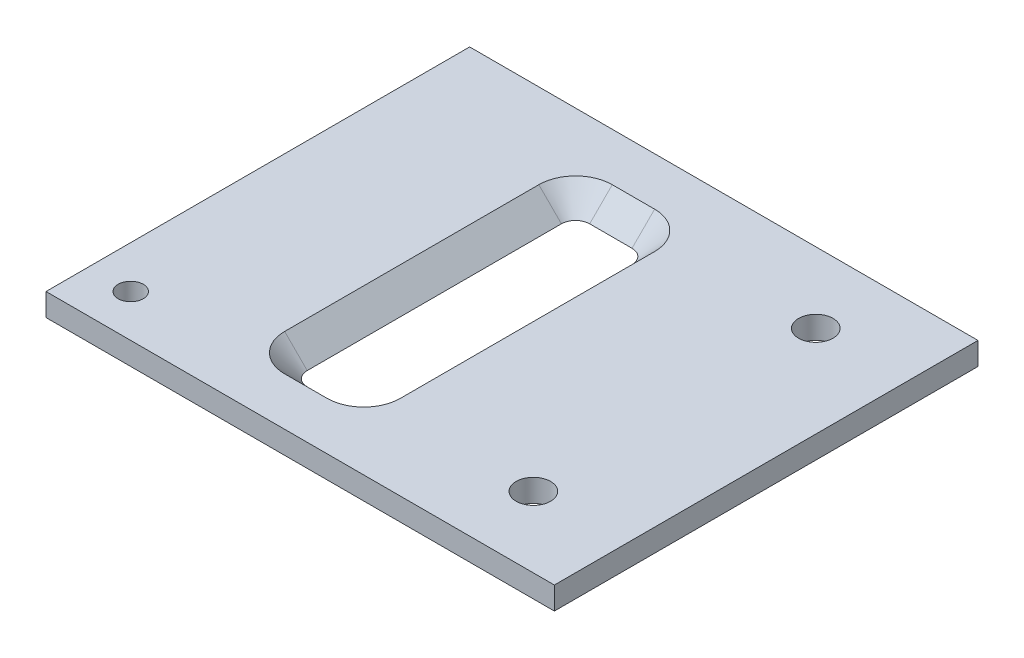
from build123d import *

# Parameters (mm, degrees)
SKETCH2_W             = 36
SKETCH2_H             = 30
BOSS_EXTRUDE1_DEPTH   = 1.6002
CUT_EXTRUDE4_DEPTH    = 26.856539599
CUT_EXTRUDE4_TAPER    = -45
F_2_CLEARANCE_HOLE1_D = 2.4384
F_0_CLEARANCE_HOLE1_D = 1.778


with BuildPart() as part:
    # Sketch2 → Boss-Extrude1 (new body)
    with BuildSketch(Plane(origin=(0, 0, 0), x_dir=(1, 0, 0), z_dir=(0, 1, 0))):
        with Locations((3, 0)):
            Rectangle(SKETCH2_W, SKETCH2_H)
    extrude(amount=BOSS_EXTRUDE1_DEPTH)

    # Sketch4 → Cut-Extrude4 (cut, through all)
    with BuildSketch(Plane(origin=(0, 0, 0), x_dir=(1, 0, 0), z_dir=(0, 1, 0))):
        with BuildLine():
            ThreePointArc((1.5, -10), (2.207106781, -9.707106781), (2.5, -9))
            Line((2.5, -9), (2.5, 9))
            ThreePointArc((2.5, 9), (2.207106781, 9.707106781), (1.5, 10))
            Line((1.5, 10), (-1.5, 10))
            ThreePointArc((-1.5, 10), (-2.207106781, 9.707106781), (-2.5, 9))
            Line((-2.5, 9), (-2.5, -9))
            ThreePointArc((-2.5, -9), (-2.207106781, -9.707106781), (-1.5, -10))
            Line((-1.5, -10), (1.5, -10))
        make_face()
    extrude(amount=CUT_EXTRUDE4_DEPTH, taper=CUT_EXTRUDE4_TAPER, mode=Mode.SUBTRACT)

    # #2 Clearance Hole1 (through all)
    with Locations(Plane(origin=(0, 0, 0), x_dir=(-1, 0, 0), z_dir=(0, -1, 0))):
        with Locations((-14.513821803, -10), (-14.513821803, 10)):
            Hole(F_2_CLEARANCE_HOLE1_D / 2)

    # #0 Clearance Hole1 (through all)
    with Locations(Plane(origin=(0, 0, 0), x_dir=(-1, 0, 0), z_dir=(0, -1, 0))):
        with Locations((12, -12)):
            Hole(F_0_CLEARANCE_HOLE1_D / 2)


solid = part.part
